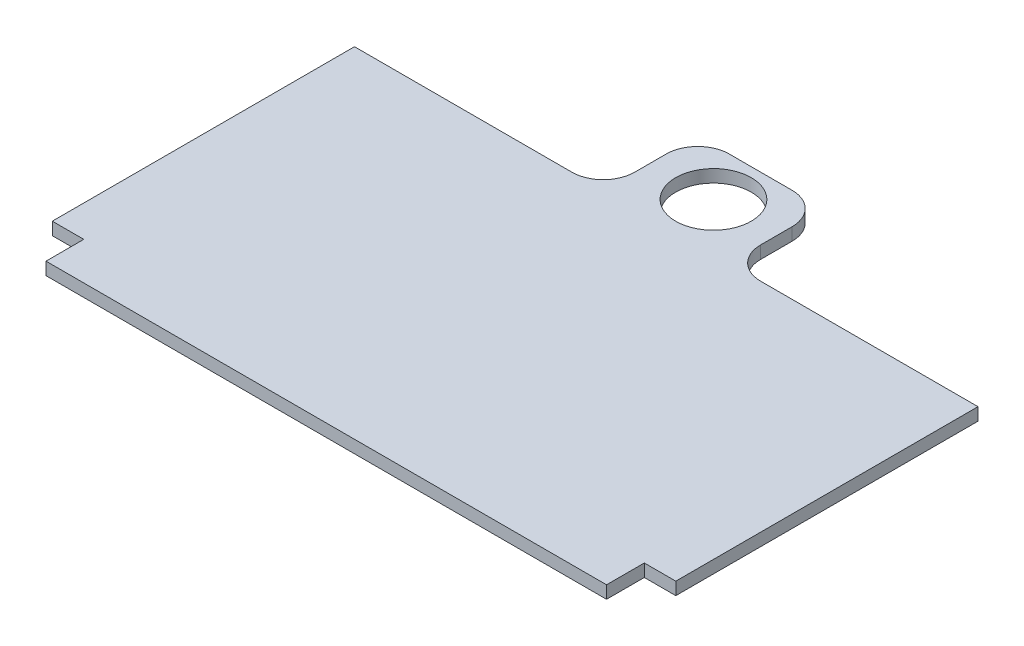
from build123d import *

# Parameters (mm, degrees)
ESTRUSIONE_ESTRUSIONE1_DEPTH      = 48
ESTRUSIONE_ESTRUSIONE1_DEPTH_BACK = 6
SCHIZZO1_W                        = 89.03043591
SCHIZZO1_H                        = 2
SCHIZZO2_W                        = 45
SCHIZZO2_H                        = 2
ESTRUSIONE_ESTRUSIONE2_DEPTH      = 5
SCHIZZO3_W                        = 5
SCHIZZO3_H                        = 2
ESTRUSIONE_ESTRUSIONE3_DEPTH      = 3
SCHIZZO4_W                        = 20
SCHIZZO4_H                        = 15
ESTRUSIONE_ESTRUSIONE4_DEPTH      = 2
SCHIZZO5_R                        = 6
TAGLIO_ESTRUSIONE1_DEPTH          = 10
RACCORDO1_R                       = 5
CORPO_SPOSTA_COPIA3_START         = -88.5
CORPO_SPOSTA_COPIA3_OUTLINE_R     = 6
CORPO_SPOSTA_COPIA3_DEPTH         = 2
CORPO_SPOSTA_COPIA3_2_OUTLINE_R   = 6
CORPO_SPOSTA_COPIA3_2_DEPTH       = 2


# Read off the part's stored shape, not the designer's step: Corpo-Sposta/copia3
with BuildPart() as part:
    # Schizzo1 → Estrusione-Estrusione1 (new, two sides: drawn at the far end of the back side and taken through both)
    with BuildSketch(Plane.XY.offset(-ESTRUSIONE_ESTRUSIONE1_DEPTH_BACK)):
        with Locations((129.515217955, -87.5)):
            Rectangle(SCHIZZO1_W, SCHIZZO1_H)
    extrude(amount=ESTRUSIONE_ESTRUSIONE1_DEPTH + ESTRUSIONE_ESTRUSIONE1_DEPTH_BACK)

    # Schizzo2 → Estrusione-Estrusione2 (add)
    with BuildSketch(Plane(origin=(174.03043591, 0, 0), x_dir=(0, 0, -1), z_dir=(1, 0, 0))):
        with Locations((-22.5, -87.5)):
            Rectangle(SCHIZZO2_W, SCHIZZO2_H)
    estrusione_estrusione2 = extrude(amount=ESTRUSIONE_ESTRUSIONE2_DEPTH)

    # Schizzo3 → Estrusione-Estrusione3 (add)
    with BuildSketch(Plane.XY.offset(45)):
        with Locations((176.53043591, -87.5)):
            Rectangle(SCHIZZO3_W, SCHIZZO3_H)
    estrusione_estrusione3 = extrude(amount=ESTRUSIONE_ESTRUSIONE3_DEPTH)

    # Specchia1: Estrusione-Estrusione2, Estrusione-Estrusione3 across plane
    add(estrusione_estrusione2.mirror(Plane(origin=(129.515217955, 0, 0), x_dir=(0, 0, 1), z_dir=(1, 0, 0))))
    add(estrusione_estrusione3.mirror(Plane(origin=(129.515217955, 0, 0), x_dir=(0, 0, 1), z_dir=(1, 0, 0))))

    # Schizzo4 → Estrusione-Estrusione4 (add)
    with BuildSketch(Plane(origin=(0, -88.5, 0), x_dir=(-1, 0, 0), z_dir=(0, -1, 0))):
        with Locations((-129.515217955, -55.5)):
            Rectangle(SCHIZZO4_W, SCHIZZO4_H)
    extrude(amount=-ESTRUSIONE_ESTRUSIONE4_DEPTH)

    # Schizzo5 → Taglio-Estrusione1 (cut)
    with BuildSketch(Plane.XZ.offset(88.5)):
        with Locations(Location((129.515217955, 55.5, 0), (0, 0, 270))):
            Circle(SCHIZZO5_R)
    extrude(amount=-TAGLIO_ESTRUSIONE1_DEPTH, mode=Mode.SUBTRACT)

    # Raccordo1
    raccordo1_edges = [part.edges().sort_by_distance(p)[0] for p in [
        (139.515217955, -87.5, 63),
        (139.515217955, -87.5, 48),
        (119.515217955, -87.5, 48),
        (119.515217955, -87.5, 63),
    ]]
    fillet(raccordo1_edges, radius=RACCORDO1_R)

    # Corpo-Sposta/copia3 outline → Corpo-Sposta/copia3 (cut)
    with BuildSketch(Plane(origin=(0, 0, 0), x_dir=(1, 0, 0), z_dir=(0, 1, 0)).offset(CORPO_SPOSTA_COPIA3_START)):
        with BuildLine():
            Line((179.03043591, -48), (179.03043591, 0))
            Line((179.03043591, 0), (174.03043591, 0))
            Line((174.03043591, 0), (174.03043591, -6))
            Line((174.03043591, -6), (85, -6))
            Line((85, -6), (85, 0))
            Line((85, 0), (80, 0))
            Line((80, 0), (80, -48))
            Line((80, -48), (114.515217955, -48))
            ThreePointArc((114.515217955, -48), (118.050751861, -49.464466094), (119.515217955, -53))
            Line((119.515217955, -53), (119.515217955, -58))
            ThreePointArc((119.515217955, -58), (120.979684049, -61.535533906), (124.515217955, -63))
            Line((124.515217955, -63), (134.515217955, -63))
            ThreePointArc((134.515217955, -63), (138.050751861, -61.535533906), (139.515217955, -58))
            Line((139.515217955, -58), (139.515217955, -53))
            ThreePointArc((139.515217955, -53), (140.979684049, -49.464466094), (144.515217955, -48))
            Line((144.515217955, -48), (179.03043591, -48))
        make_face()
        with Locations((129.515217955, -55.5)):
            Circle(CORPO_SPOSTA_COPIA3_OUTLINE_R, mode=Mode.SUBTRACT)
    extrude(amount=CORPO_SPOSTA_COPIA3_DEPTH, mode=Mode.SUBTRACT)

    # Corpo-Sposta_copia3 2 outline → Corpo-Sposta_copia3 2 (add)
    with BuildSketch(Plane(origin=(0, 0, 0), x_dir=(1, 0, 0), z_dir=(0, 1, 0)).offset(CORPO_SPOSTA_COPIA3_START)):
        with BuildLine():
            Line((179.03043591, 0), (179.03043591, 48))
            Line((179.03043591, 48), (144.515217955, 48))
            ThreePointArc((144.515217955, 48), (140.979684049, 49.464466094), (139.515217955, 53))
            Line((139.515217955, 53), (139.515217955, 58))
            ThreePointArc((139.515217955, 58), (138.050751861, 61.535533906), (134.515217955, 63))
            Line((134.515217955, 63), (124.515217955, 63))
            ThreePointArc((124.515217955, 63), (120.979684049, 61.535533906), (119.515217955, 58))
            Line((119.515217955, 58), (119.515217955, 53))
            ThreePointArc((119.515217955, 53), (118.050751861, 49.464466094), (114.515217955, 48))
            Line((114.515217955, 48), (80, 48))
            Line((80, 48), (80, 0))
            Line((80, 0), (85, 0))
            Line((85, 0), (85, 6))
            Line((85, 6), (174.03043591, 6))
            Line((174.03043591, 6), (174.03043591, 0))
            Line((174.03043591, 0), (179.03043591, 0))
        make_face()
        with Locations((129.515217955, 55.5)):
            Circle(CORPO_SPOSTA_COPIA3_2_OUTLINE_R, mode=Mode.SUBTRACT)
    extrude(amount=CORPO_SPOSTA_COPIA3_2_DEPTH)


solid = part.part
